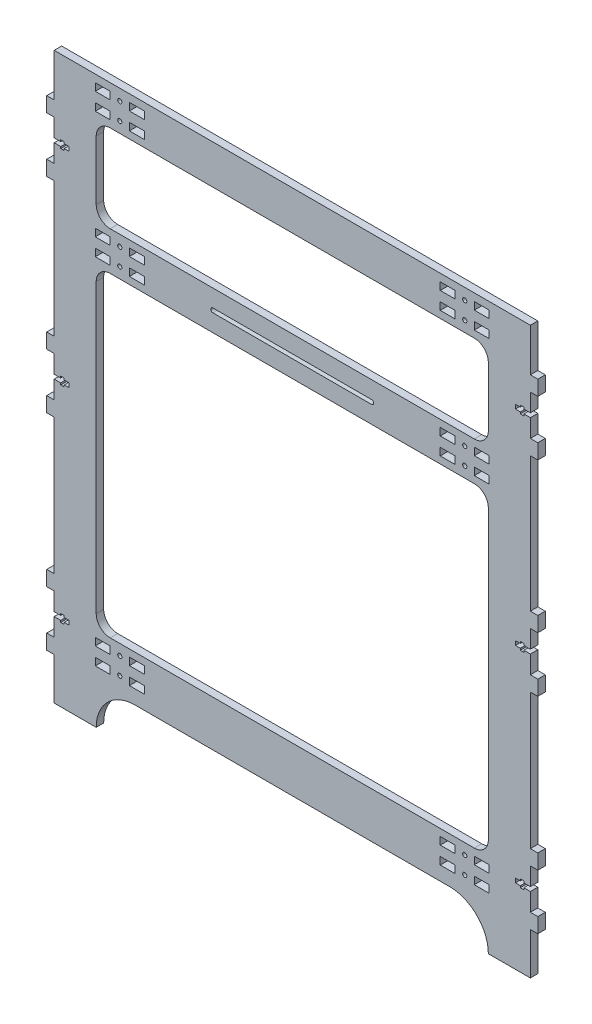
from build123d import *

# Parameters (mm, degrees)
SKETCH1_SIDE_SKETCH_2_W = 10.666
SKETCH1_SIDE_SKETCH_2_H = 5.333
SKETCH1_SIDE_SKETCH_2_R = 1.5
BOSS_EXTRUDE1_DEPTH     = 5.333


with BuildPart() as part:
    # Sketch1-Side Sketch<2> → Boss-Extrude1 (new body)
    with BuildSketch(Plane.XY):
        with BuildLine():
            Line((170, 100.666), (-170, 100.666))
            Line((-170, 100.666), (-170, 70))
            Line((-170, 70), (-175.333, 70))
            Line((-175.333, 70), (-175.333, 59.334))
            Line((-175.333, 59.334), (-170, 59.334))
            Line((-170, 59.334), (-170, 46.5))
            Line((-170, 46.5), (-165.333, 46.5))
            Line((-165.333, 46.5), (-165.333, 47.75))
            Line((-165.333, 47.75), (-162.833, 47.75))
            Line((-162.833, 47.75), (-162.833, 46.5))
            Line((-162.833, 46.5), (-159.333, 46.5))
            Line((-159.333, 46.5), (-159.333, 43.5))
            Line((-159.333, 43.5), (-162.833, 43.5))
            Line((-162.833, 43.5), (-162.833, 42.25))
            Line((-162.833, 42.25), (-165.333, 42.25))
            Line((-165.333, 42.25), (-165.333, 43.5))
            Line((-165.333, 43.5), (-170, 43.5))
            Line((-170, 43.5), (-170, 30.666))
            Line((-170, 30.666), (-175.333, 30.666))
            Line((-175.333, 30.666), (-175.333, 20))
            Line((-175.333, 20), (-170, 20))
            Line((-170, 20), (-170, -76.167))
            Line((-170, -76.167), (-175.333, -76.167))
            Line((-175.333, -76.167), (-175.333, -86.833))
            Line((-175.333, -86.833), (-170, -86.833))
            Line((-170, -86.833), (-170, -99.667))
            Line((-170, -99.667), (-165.333, -99.667))
            Line((-165.333, -99.667), (-165.333, -98.417))
            Line((-165.333, -98.417), (-162.833, -98.417))
            Line((-162.833, -98.417), (-162.833, -99.667))
            Line((-162.833, -99.667), (-159.333, -99.667))
            Line((-159.333, -99.667), (-159.333, -102.667))
            Line((-159.333, -102.667), (-162.833, -102.667))
            Line((-162.833, -102.667), (-162.833, -103.917))
            Line((-162.833, -103.917), (-165.333, -103.917))
            Line((-165.333, -103.917), (-165.333, -102.667))
            Line((-165.333, -102.667), (-170, -102.667))
            Line((-170, -102.667), (-170, -115.501))
            Line((-170, -115.501), (-175.333, -115.501))
            Line((-175.333, -115.501), (-175.333, -126.167))
            Line((-175.333, -126.167), (-170, -126.167))
            Line((-170, -126.167), (-170, -223))
            Line((-170, -223), (-175.333, -223))
            Line((-175.333, -223), (-175.333, -233.666))
            Line((-175.333, -233.666), (-170, -233.666))
            Line((-170, -233.666), (-170, -246.5))
            Line((-170, -246.5), (-165.333, -246.5))
            Line((-165.333, -246.5), (-165.333, -245.25))
            Line((-165.333, -245.25), (-162.833, -245.25))
            Line((-162.833, -245.25), (-162.833, -246.5))
            Line((-162.833, -246.5), (-159.333, -246.5))
            Line((-159.333, -246.5), (-159.333, -249.5))
            Line((-159.333, -249.5), (-162.833, -249.5))
            Line((-162.833, -249.5), (-162.833, -250.75))
            Line((-162.833, -250.75), (-165.333, -250.75))
            Line((-165.333, -250.75), (-165.333, -249.5))
            Line((-165.333, -249.5), (-170, -249.5))
            Line((-170, -249.5), (-170, -262.334))
            Line((-170, -262.334), (-175.333, -262.334))
            Line((-175.333, -262.334), (-175.333, -273))
            Line((-175.333, -273), (-170, -273))
            Line((-170, -273), (-170, -303))
            Line((-170, -303), (-140, -303))
            ThreePointArc((-140, -303), (-131.896523315, -283.436476685), (-112.333, -275.333))
            Line((-112.333, -275.333), (112.333, -275.333))
            ThreePointArc((112.333, -275.333), (131.896523315, -283.436476685), (140, -303))
            Line((140, -303), (170, -303))
            Line((170, -303), (170, -273))
            Line((170, -273), (175.333, -273))
            Line((175.333, -273), (175.333, -262.334))
            Line((175.333, -262.334), (170, -262.334))
            Line((170, -262.334), (170, -249.5))
            Line((170, -249.5), (165.333, -249.5))
            Line((165.333, -249.5), (165.333, -250.75))
            Line((165.333, -250.75), (162.833, -250.75))
            Line((162.833, -250.75), (162.833, -249.5))
            Line((162.833, -249.5), (159.333, -249.5))
            Line((159.333, -249.5), (159.333, -246.5))
            Line((159.333, -246.5), (162.833, -246.5))
            Line((162.833, -246.5), (162.833, -245.25))
            Line((162.833, -245.25), (165.333, -245.25))
            Line((165.333, -245.25), (165.333, -246.5))
            Line((165.333, -246.5), (170, -246.5))
            Line((170, -246.5), (170, -233.666))
            Line((170, -233.666), (175.333, -233.666))
            Line((175.333, -233.666), (175.333, -223))
            Line((175.333, -223), (170, -223))
            Line((170, -223), (170, -126.167))
            Line((170, -126.167), (175.333, -126.167))
            Line((175.333, -126.167), (175.333, -115.501))
            Line((175.333, -115.501), (170, -115.501))
            Line((170, -115.501), (170, -102.667))
            Line((170, -102.667), (165.333, -102.667))
            Line((165.333, -102.667), (165.333, -103.917))
            Line((165.333, -103.917), (162.833, -103.917))
            Line((162.833, -103.917), (162.833, -102.667))
            Line((162.833, -102.667), (159.333, -102.667))
            Line((159.333, -102.667), (159.333, -99.667))
            Line((159.333, -99.667), (162.833, -99.667))
            Line((162.833, -99.667), (162.833, -98.417))
            Line((162.833, -98.417), (165.333, -98.417))
            Line((165.333, -98.417), (165.333, -99.667))
            Line((165.333, -99.667), (170, -99.667))
            Line((170, -99.667), (170, -86.833))
            Line((170, -86.833), (175.333, -86.833))
            Line((175.333, -86.833), (175.333, -76.167))
            Line((175.333, -76.167), (170, -76.167))
            Line((170, -76.167), (170, 20))
            Line((170, 20), (175.333, 20))
            Line((175.333, 20), (175.333, 30.666))
            Line((175.333, 30.666), (170, 30.666))
            Line((170, 30.666), (170, 43.5))
            Line((170, 43.5), (165.333, 43.5))
            Line((165.333, 43.5), (165.333, 42.25))
            Line((165.333, 42.25), (162.833, 42.25))
            Line((162.833, 42.25), (162.833, 43.5))
            Line((162.833, 43.5), (159.333, 43.5))
            Line((159.333, 43.5), (159.333, 46.5))
            Line((159.333, 46.5), (162.833, 46.5))
            Line((162.833, 46.5), (162.833, 47.75))
            Line((162.833, 47.75), (165.333, 47.75))
            Line((165.333, 47.75), (165.333, 46.5))
            Line((165.333, 46.5), (170, 46.5))
            Line((170, 46.5), (170, 59.334))
            Line((170, 59.334), (175.333, 59.334))
            Line((175.333, 59.334), (175.333, 70))
            Line((175.333, 70), (170, 70))
            Line((170, 70), (170, 100.666))
        make_face()
        with Locations((-135.320282912, -262.6665)):
            Rectangle(SKETCH1_SIDE_SKETCH_2_W, SKETCH1_SIDE_SKETCH_2_H, mode=Mode.SUBTRACT)
        with Locations((-123.153282912, -262.6665)):
            Circle(SKETCH1_SIDE_SKETCH_2_R, mode=Mode.SUBTRACT)
        with Locations((-110.986282912, -262.6665)):
            Rectangle(SKETCH1_SIDE_SKETCH_2_W, SKETCH1_SIDE_SKETCH_2_H, mode=Mode.SUBTRACT)
        with Locations((-135.320282912, -250.3335)):
            Rectangle(SKETCH1_SIDE_SKETCH_2_W, SKETCH1_SIDE_SKETCH_2_H, mode=Mode.SUBTRACT)
        with Locations((-123.153282912, -250.3335)):
            Circle(SKETCH1_SIDE_SKETCH_2_R, mode=Mode.SUBTRACT)
        with Locations((-110.986282912, -250.3335)):
            Rectangle(SKETCH1_SIDE_SKETCH_2_W, SKETCH1_SIDE_SKETCH_2_H, mode=Mode.SUBTRACT)
        with Locations((110.986282912, -262.6665)):
            Rectangle(SKETCH1_SIDE_SKETCH_2_W, SKETCH1_SIDE_SKETCH_2_H, mode=Mode.SUBTRACT)
        with Locations((123.153282912, -262.6665)):
            Circle(SKETCH1_SIDE_SKETCH_2_R, mode=Mode.SUBTRACT)
        with Locations((135.320282912, -262.6665)):
            Rectangle(SKETCH1_SIDE_SKETCH_2_W, SKETCH1_SIDE_SKETCH_2_H, mode=Mode.SUBTRACT)
        with Locations((110.986282912, -250.3335)):
            Rectangle(SKETCH1_SIDE_SKETCH_2_W, SKETCH1_SIDE_SKETCH_2_H, mode=Mode.SUBTRACT)
        with Locations((123.153282912, -250.3335)):
            Circle(SKETCH1_SIDE_SKETCH_2_R, mode=Mode.SUBTRACT)
        with Locations((135.320282912, -250.3335)):
            Rectangle(SKETCH1_SIDE_SKETCH_2_W, SKETCH1_SIDE_SKETCH_2_H, mode=Mode.SUBTRACT)
        with BuildLine():
            Line((-130, -17.333), (130, -17.333))
            ThreePointArc((130, -17.333), (137.071067812, -20.261932188), (140, -27.333))
            Line((140, -27.333), (140, -232.667))
            ThreePointArc((140, -232.667), (137.071067812, -239.738067812), (130, -242.667))
            Line((130, -242.667), (-130, -242.667))
            ThreePointArc((-130, -242.667), (-137.071067812, -239.738067812), (-140, -232.667))
            Line((-140, -232.667), (-140, -27.333))
            ThreePointArc((-140, -27.333), (-137.071067812, -20.261932188), (-130, -17.333))
        make_face(mode=Mode.SUBTRACT)
        with Locations((-135.320282912, -9.6665)):
            Rectangle(SKETCH1_SIDE_SKETCH_2_W, SKETCH1_SIDE_SKETCH_2_H, mode=Mode.SUBTRACT)
        with Locations((-123.153282912, -9.6665)):
            Circle(SKETCH1_SIDE_SKETCH_2_R, mode=Mode.SUBTRACT)
        with Locations((-110.986282912, -9.6665)):
            Rectangle(SKETCH1_SIDE_SKETCH_2_W, SKETCH1_SIDE_SKETCH_2_H, mode=Mode.SUBTRACT)
        with BuildLine():
            ThreePointArc((-56.666666667, -5), (-58.166666667, -3.5), (-56.666666667, -2))
            Line((-56.666666667, -2), (56.666666667, -2))
            ThreePointArc((56.666666667, -2), (58.166666667, -3.5), (56.666666667, -5))
            Line((56.666666667, -5), (-56.666666667, -5))
        make_face(mode=Mode.SUBTRACT)
        with Locations((-135.320282912, 2.6665)):
            Rectangle(SKETCH1_SIDE_SKETCH_2_W, SKETCH1_SIDE_SKETCH_2_H, mode=Mode.SUBTRACT)
        with Locations((-123.153282912, 2.6665)):
            Circle(SKETCH1_SIDE_SKETCH_2_R, mode=Mode.SUBTRACT)
        with Locations((-110.986282912, 2.6665)):
            Rectangle(SKETCH1_SIDE_SKETCH_2_W, SKETCH1_SIDE_SKETCH_2_H, mode=Mode.SUBTRACT)
        with Locations((-135.320282912, 80.3335)):
            Rectangle(SKETCH1_SIDE_SKETCH_2_W, SKETCH1_SIDE_SKETCH_2_H, mode=Mode.SUBTRACT)
        with Locations((-123.153282912, 80.3335)):
            Circle(SKETCH1_SIDE_SKETCH_2_R, mode=Mode.SUBTRACT)
        with Locations((-135.320282912, 92.6665)):
            Rectangle(SKETCH1_SIDE_SKETCH_2_W, SKETCH1_SIDE_SKETCH_2_H, mode=Mode.SUBTRACT)
        with Locations((-123.153282912, 92.6665)):
            Circle(SKETCH1_SIDE_SKETCH_2_R, mode=Mode.SUBTRACT)
        with Locations((-110.986282912, 80.3335)):
            Rectangle(SKETCH1_SIDE_SKETCH_2_W, SKETCH1_SIDE_SKETCH_2_H, mode=Mode.SUBTRACT)
        with Locations((-110.986282912, 92.6665)):
            Rectangle(SKETCH1_SIDE_SKETCH_2_W, SKETCH1_SIDE_SKETCH_2_H, mode=Mode.SUBTRACT)
        with BuildLine():
            Line((-130, 72.667), (130, 72.667))
            ThreePointArc((130, 72.667), (137.071067812, 69.738067812), (140, 62.667))
            Line((140, 62.667), (140, 20.333))
            ThreePointArc((140, 20.333), (137.071067812, 13.261932188), (130, 10.333))
            Line((130, 10.333), (-130, 10.333))
            ThreePointArc((-130, 10.333), (-137.071067812, 13.261932188), (-140, 20.333))
            Line((-140, 20.333), (-140, 62.667))
            ThreePointArc((-140, 62.667), (-137.071067812, 69.738067812), (-130, 72.667))
        make_face(mode=Mode.SUBTRACT)
        with Locations((110.986282912, -9.6665)):
            Rectangle(SKETCH1_SIDE_SKETCH_2_W, SKETCH1_SIDE_SKETCH_2_H, mode=Mode.SUBTRACT)
        with Locations((123.153282912, -9.6665)):
            Circle(SKETCH1_SIDE_SKETCH_2_R, mode=Mode.SUBTRACT)
        with Locations((135.320282912, -9.6665)):
            Rectangle(SKETCH1_SIDE_SKETCH_2_W, SKETCH1_SIDE_SKETCH_2_H, mode=Mode.SUBTRACT)
        with Locations((110.986282912, 2.6665)):
            Rectangle(SKETCH1_SIDE_SKETCH_2_W, SKETCH1_SIDE_SKETCH_2_H, mode=Mode.SUBTRACT)
        with Locations((123.153282912, 2.6665)):
            Circle(SKETCH1_SIDE_SKETCH_2_R, mode=Mode.SUBTRACT)
        with Locations((135.320282912, 2.6665)):
            Rectangle(SKETCH1_SIDE_SKETCH_2_W, SKETCH1_SIDE_SKETCH_2_H, mode=Mode.SUBTRACT)
        with Locations((110.986282912, 80.3335)):
            Rectangle(SKETCH1_SIDE_SKETCH_2_W, SKETCH1_SIDE_SKETCH_2_H, mode=Mode.SUBTRACT)
        with Locations((110.986282912, 92.6665)):
            Rectangle(SKETCH1_SIDE_SKETCH_2_W, SKETCH1_SIDE_SKETCH_2_H, mode=Mode.SUBTRACT)
        with Locations((123.153282912, 80.3335)):
            Circle(SKETCH1_SIDE_SKETCH_2_R, mode=Mode.SUBTRACT)
        with Locations((135.320282912, 80.3335)):
            Rectangle(SKETCH1_SIDE_SKETCH_2_W, SKETCH1_SIDE_SKETCH_2_H, mode=Mode.SUBTRACT)
        with Locations((123.153282912, 92.6665)):
            Circle(SKETCH1_SIDE_SKETCH_2_R, mode=Mode.SUBTRACT)
        with Locations((135.320282912, 92.6665)):
            Rectangle(SKETCH1_SIDE_SKETCH_2_W, SKETCH1_SIDE_SKETCH_2_H, mode=Mode.SUBTRACT)
    extrude(amount=BOSS_EXTRUDE1_DEPTH)


solid = part.part
